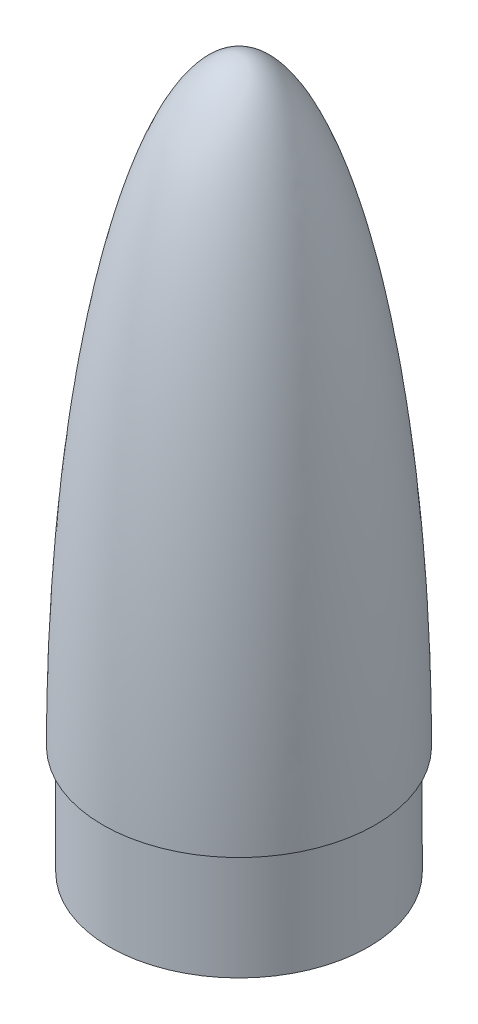
from build123d import *

# Parameters (mm, degrees)
SKETCH_4_R      = 23.8
EXTRUDE_2_DEPTH = 20


with BuildPart() as part:
    # Эскиз1 → Повернуть1 (revolve)
    with BuildSketch(Plane.XY):
        with BuildLine():
            add(Edge.make_bspline(
                [(25, 0), (25, 110), (0, 110)],
                knots=[1.570796327, 1.570796327, 1.570796327, 3.141592654, 3.141592654, 3.141592654], degree=2, weights=[1, 0.707106781, 1]))
            Line((0, 110), (0, 0))
            Line((0, 0), (25, 0))
        make_face()
    revolve(axis=Axis((0, 110, 0), (0, -1, 0)))

    # Эскиз4 → Бобышка-Вытянуть2 (add)
    with BuildSketch(Plane(origin=(0, 0, 0), x_dir=(-1, 0, 0), z_dir=(0, -1, 0))):
        Circle(SKETCH_4_R)
    extrude(amount=EXTRUDE_2_DEPTH)


solid = part.part
